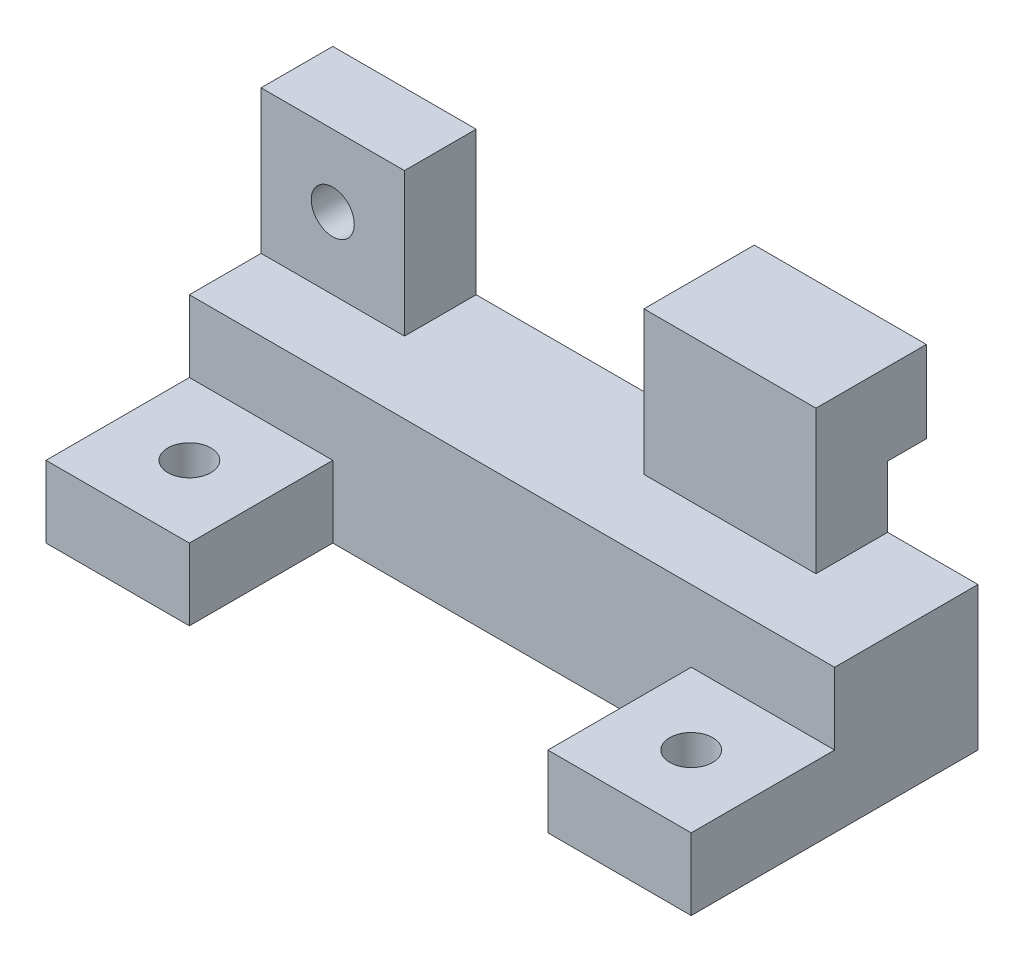
from build123d import *

# Parameters (mm, degrees)
SKETCH1_W           = 45
SKETCH1_H           = 10
BOSS_EXTRUDE1_DEPTH = 10
SKETCH2_W           = 10
SKETCH2_H           = 5
SKETCH2_W_2         = 12
BOSS_EXTRUDE2_DEPTH = 10
SKETCH3_W           = 10
SKETCH3_H           = 5
BOSS_EXTRUDE3_DEPTH = 10
SKETCH4_R           = 1.5
CUT_EXTRUDE1_DEPTH  = 5
SKETCH9_R           = 1.5
CUT_EXTRUDE6_DEPTH  = 5
SKETCH10_R          = 1.5
CUT_EXTRUDE7_DEPTH  = 5
SKETCH11_W          = 12
SKETCH11_H          = 5.7
BOSS_EXTRUDE4_DEPTH = 2.7
SKETCH7_W           = 10
SKETCH7_H           = 10
BOSS_EXTRUDE5_DEPTH = 35
SKETCH13_W          = 12
SKETCH13_H          = 5
BOSS_EXTRUDE6_DEPTH = 10
SKETCH14_W          = 12
SKETCH14_H          = 5.7
BOSS_EXTRUDE7_DEPTH = 2.7
SKETCH15_W          = 25
SKETCH15_H          = 20
CUT_EXTRUDE9_DEPTH  = 50
SKETCH16_W          = 10
SKETCH16_H          = 5
BOSS_EXTRUDE8_DEPTH = 10
SKETCH17_R          = 1.5
CUT_EXTRUDE10_DEPTH = 5


with BuildPart() as part:
    # Sketch1 → Boss-Extrude1 (new body)
    with BuildSketch(Plane.XY):
        with Locations((22.5, 5)):
            Rectangle(SKETCH1_W, SKETCH1_H)
    extrude(amount=BOSS_EXTRUDE1_DEPTH)

    # Sketch2 → Boss-Extrude2 (add)
    with BuildSketch(Plane(origin=(0, 10, 0), x_dir=(1, 0, 0), z_dir=(0, 1, 0))):
        with Locations((40, -2.5)):
            Rectangle(SKETCH2_W, SKETCH2_H)
        with Locations((12.3, -2.5)):
            Rectangle(SKETCH2_W_2, SKETCH2_H)
    extrude(amount=BOSS_EXTRUDE2_DEPTH)

    # Sketch3 → Boss-Extrude3 (add)
    with BuildSketch(Plane.XY.offset(10)):
        with Locations((5, 2.5)):
            Rectangle(SKETCH3_W, SKETCH3_H)
        with Locations((40, 2.5)):
            Rectangle(SKETCH3_W, SKETCH3_H)
    extrude(amount=BOSS_EXTRUDE3_DEPTH)

    # Sketch4 → Cut-Extrude1 (cut)
    with BuildSketch(Plane.ZY):
        with Locations((5, 5)):
            Circle(SKETCH4_R)
    extrude(amount=-CUT_EXTRUDE1_DEPTH, mode=Mode.SUBTRACT)

    # Sketch9 → Cut-Extrude6 (cut)
    with BuildSketch(Plane(origin=(0, 5, 0), x_dir=(1, 0, 0), z_dir=(0, 1, 0))):
        with Locations((40, -15)):
            Circle(SKETCH9_R)
    extrude(amount=-CUT_EXTRUDE6_DEPTH, mode=Mode.SUBTRACT)

    # Sketch10 → Cut-Extrude7 (cut)
    with BuildSketch(Plane.XY.offset(5)):
        with Locations((40, 15)):
            Circle(SKETCH10_R)
    extrude(amount=-CUT_EXTRUDE7_DEPTH, mode=Mode.SUBTRACT)

    # Sketch11 → Boss-Extrude4 (add)
    with BuildSketch(Plane(origin=(0, 0, 0), x_dir=(-1, 0, 0), z_dir=(0, 0, -1))):
        with Locations((-12.3, 17.15)):
            Rectangle(SKETCH11_W, SKETCH11_H)
    extrude(amount=BOSS_EXTRUDE4_DEPTH)

    # Sketch7 → Boss-Extrude5 (add)
    with BuildSketch(Plane(origin=(45, 0, 0), x_dir=(0, 0, -1), z_dir=(1, 0, 0))):
        with Locations((-5, 5)):
            Rectangle(SKETCH7_W, SKETCH7_H)
    extrude(amount=BOSS_EXTRUDE5_DEPTH)

    # Sketch13 → Boss-Extrude6 (add)
    with BuildSketch(Plane(origin=(0, 10, 0), x_dir=(1, 0, 0), z_dir=(0, 1, 0))):
        with Locations((67.7, -2.5)):
            Rectangle(SKETCH13_W, SKETCH13_H)
    extrude(amount=BOSS_EXTRUDE6_DEPTH)

    # Sketch14 → Boss-Extrude7 (add)
    with BuildSketch(Plane(origin=(0, 0, 0), x_dir=(-1, 0, 0), z_dir=(0, 0, -1))):
        with Locations((-67.7, 17.15)):
            Rectangle(SKETCH14_W, SKETCH14_H)
    extrude(amount=BOSS_EXTRUDE7_DEPTH)

    # Sketch15 → Cut-Extrude9 (cut)
    with BuildSketch(Plane.ZY.offset(-35)):
        with Locations((7.5, 10)):
            Rectangle(SKETCH15_W, SKETCH15_H)
    extrude(amount=CUT_EXTRUDE9_DEPTH, mode=Mode.SUBTRACT)

    # Sketch16 → Boss-Extrude8 (add)
    with BuildSketch(Plane.XY.offset(10)):
        with Locations((75, 2.5)):
            Rectangle(SKETCH16_W, SKETCH16_H)
    extrude(amount=BOSS_EXTRUDE8_DEPTH)

    # Sketch17 → Cut-Extrude10 (cut)
    with BuildSketch(Plane(origin=(0, 5, 0), x_dir=(1, 0, 0), z_dir=(0, 1, 0))):
        with Locations((75, -15)):
            Circle(SKETCH17_R)
    extrude(amount=-CUT_EXTRUDE10_DEPTH, mode=Mode.SUBTRACT)


solid = part.part
